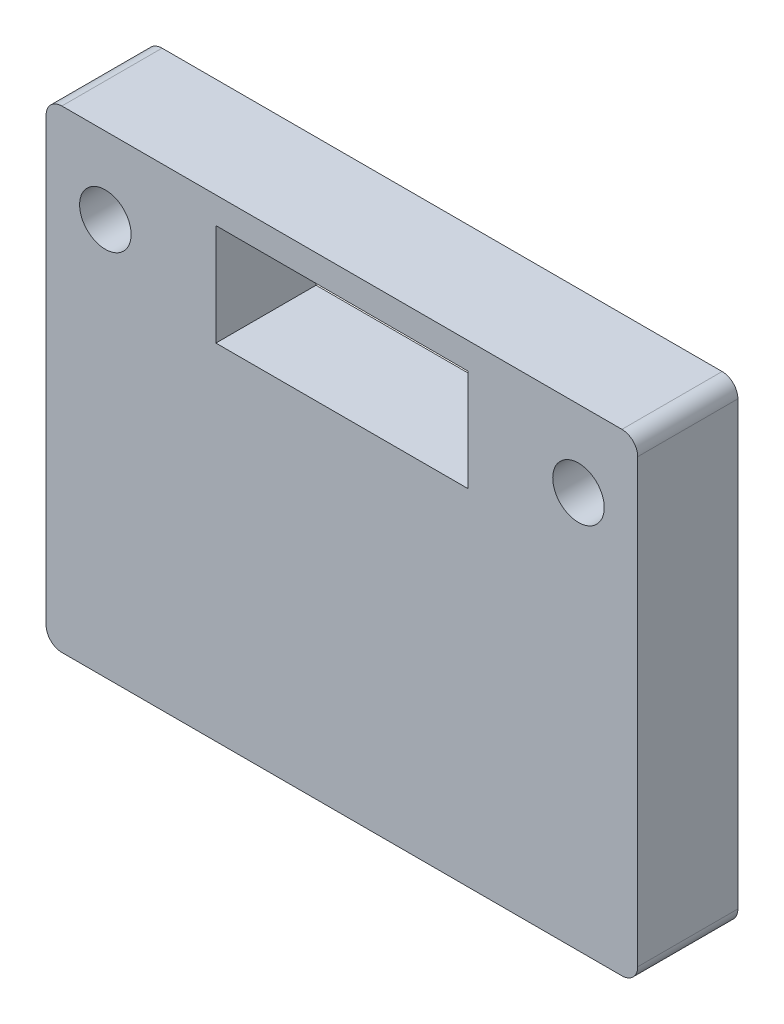
from build123d import *

# Parameters (mm, degrees)
SKETCH1_W                                        = 75
SKETCH1_H                                        = 60
BOSS_EXTRUDE1_DEPTH                              = 12.7
CSK_FOR_1_4_FLAT_HEAD_MACHINE_SCREW1_D           = 6.5278
CSK_FOR_1_4_FLAT_HEAD_MACHINE_SCREW1_CSINK_D     = 12.8778
CSK_FOR_1_4_FLAT_HEAD_MACHINE_SCREW1_CSINK_ANGLE = 82
FILLET1_R                                        = 2


with BuildPart() as part:
    # Sketch1 → Boss-Extrude1 (new body)
    with BuildSketch(Plane.XY):
        with Locations((37.5, -30)):
            Rectangle(SKETCH1_W, SKETCH1_H)
        Polygon((21.525, -3.367091904), (21.525, -16.267091904), (53.475, -16.267091904), (53.475, -3.367091904), (37.5, -3.367091904), align=None, mode=Mode.SUBTRACT)
    extrude(amount=BOSS_EXTRUDE1_DEPTH)

    # CSK for 1/4 Flat Head Machine Screw1 (through all)
    with Locations(Plane(origin=(0, 0, 0), x_dir=(-1, 0, 0), z_dir=(0, 0, -1))):
        with Locations((-67.49, -9.717091904), (-7.51, -9.717091904)):
            CounterSinkHole(CSK_FOR_1_4_FLAT_HEAD_MACHINE_SCREW1_D / 2, CSK_FOR_1_4_FLAT_HEAD_MACHINE_SCREW1_CSINK_D / 2, counter_sink_angle=CSK_FOR_1_4_FLAT_HEAD_MACHINE_SCREW1_CSINK_ANGLE)

    # Fillet1
    fillet1_edges = [part.edges().sort_by_distance(p)[0] for p in [
        (0, -60, 6.35),
        (0, 0, 6.35),
        (75, 0, 6.35),
        (75, -60, 6.35),
    ]]
    fillet(fillet1_edges, radius=FILLET1_R)


solid = part.part
